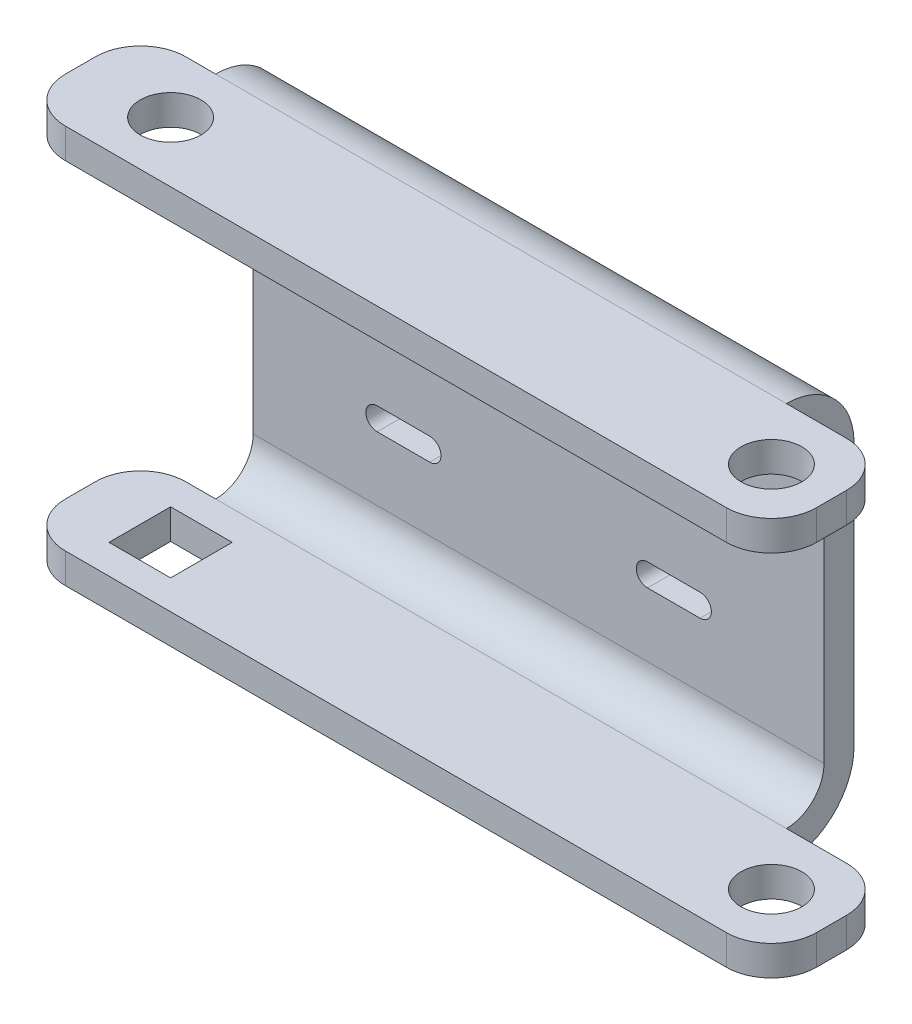
from build123d import *

# Parameters (mm, degrees)
SM_BASE_FLANGE_1_DEPTH = 100
SKETCH_4_R             = 4.05
CUT_EXTRUDE_1_DEPTH    = 116.905133622
SKETCH_5_W             = 10
SKETCH_5_H             = 9
SKETCH_5_W_2           = 14
CUT_EXTRUDE_2_DEPTH    = 116.905133622
FILLET_1_R             = 6
SKETCH_7_W             = 8.2
SKETCH_7_H             = 8.2
CUT_EXTRUDE_4_DEPTH    = 4
CUT_EXTRUDE_5_DEPTH    = 4


# Sheet-metal steps are written as plain solids
with BuildPart() as part:
    # Sketch 1 → Базовая кромка1 (new body)
    with BuildSketch(Plane(origin=(0, 0, 0), x_dir=(0, 0, -1), z_dir=(1, 0, 0))):
        with BuildLine():
            Line((-25, -53), (-9, -53))
            ThreePointArc((-9, -53), (-2.636038969, -50.363961031), (0, -44))
            Line((0, -44), (0, -9))
            ThreePointArc((0, -9), (-2.636038969, -2.636038969), (-9, 0))
            Line((-9, 0), (-25, 0))
            Line((-25, 0), (-25, -4))
            Line((-25, -4), (-9, -4))
            ThreePointArc((-9, -4), (-5.464466094, -5.464466094), (-4, -9))
            Line((-4, -9), (-4, -44))
            ThreePointArc((-4, -44), (-5.464466094, -47.535533906), (-9, -49))
            Line((-9, -49), (-25, -49))
            Line((-25, -49), (-25, -53))
        make_face()
    extrude(amount=SM_BASE_FLANGE_1_DEPTH)

    # Эскиз4 → Вырез-Вытянуть1 (cut, through all)
    with BuildSketch(Plane(origin=(0, 0, 0), x_dir=(1, 0, 0), z_dir=(0, 1, 0))):
        with Locations(Location((12, -17, 0), (0, 0, 270))):
            Circle(SKETCH_4_R)
        with Locations(Location((92, -17, 0), (0, 0, 270))):
            Circle(SKETCH_4_R)
    extrude(amount=-CUT_EXTRUDE_1_DEPTH, mode=Mode.SUBTRACT)

    # Эскиз5 → Вырез-Вытянуть2 (cut, through all)
    with BuildSketch(Plane(origin=(0, 0, 0), x_dir=(1, 0, 0), z_dir=(0, 1, 0))):
        with Locations((5, -4.5)):
            Rectangle(SKETCH_5_W, SKETCH_5_H)
        with Locations((93, -4.5)):
            Rectangle(SKETCH_5_W_2, SKETCH_5_H)
    extrude(amount=-CUT_EXTRUDE_2_DEPTH, mode=Mode.SUBTRACT)

    # Скругление1
    fillet_1_edges = [part.edges().sort_by_distance(p)[0] for p in [
        (0, -51, 25),
        (0, -2, 25),
        (100, -51, 25),
        (0, -2, 9),
        (100, -2, 9),
        (0, -51, 9),
        (100, -51, 9),
        (100, -2, 25),
    ]]
    fillet(fillet_1_edges, radius=FILLET_1_R)

    # Эскиз7 → Вырез-Вытянуть4 (cut)
    with BuildSketch(Plane.XZ.offset(53)):
        with Locations((12, 17)):
            Rectangle(SKETCH_7_W, SKETCH_7_H)
    extrude(amount=-CUT_EXTRUDE_4_DEPTH, mode=Mode.SUBTRACT)

    # Эскиз8 → Вырез-Вытянуть5 (cut)
    with BuildSketch(Plane(origin=(0, 0, 0), x_dir=(-1, 0, 0), z_dir=(0, 0, -1))):
        with BuildLine():
            Line((-69.5, -17.5), (-62.5, -17.5))
            ThreePointArc((-62.5, -17.5), (-61, -19), (-62.5, -20.5))
            Line((-62.5, -20.5), (-69.5, -20.5))
            ThreePointArc((-69.5, -20.5), (-71, -19), (-69.5, -17.5))
        make_face()
        with BuildLine():
            Line((-26.5, -17.5), (-33.5, -17.5))
            ThreePointArc((-33.5, -17.5), (-35, -19), (-33.5, -20.5))
            Line((-33.5, -20.5), (-26.5, -20.5))
            ThreePointArc((-26.5, -20.5), (-25, -19), (-26.5, -17.5))
        make_face()
        with BuildLine():
            Line((-26.5, -35.5), (-33.5, -35.5))
            ThreePointArc((-33.5, -35.5), (-35, -34), (-33.5, -32.5))
            Line((-33.5, -32.5), (-26.5, -32.5))
            ThreePointArc((-26.5, -32.5), (-25, -34), (-26.5, -35.5))
        make_face()
        with BuildLine():
            Line((-69.5, -35.5), (-62.5, -35.5))
            ThreePointArc((-62.5, -35.5), (-61, -34), (-62.5, -32.5))
            Line((-62.5, -32.5), (-69.5, -32.5))
            ThreePointArc((-69.5, -32.5), (-71, -34), (-69.5, -35.5))
        make_face()
    extrude(amount=-CUT_EXTRUDE_5_DEPTH, mode=Mode.SUBTRACT)


solid = part.part
